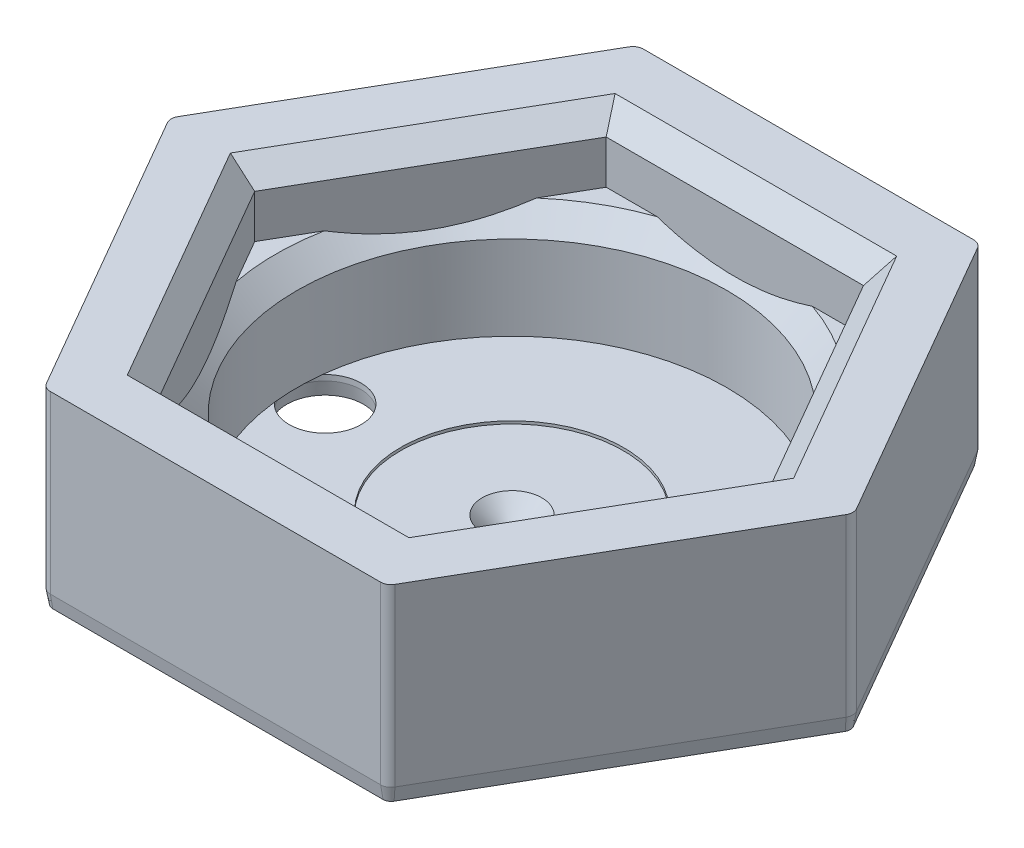
from build123d import *
from OCP.BRepFilletAPI import BRepFilletAPI_MakeChamfer

# Parameters (mm, degrees)
BOSS_EXTRUDE1_DEPTH = 27
SKETCH1_5_R         = 1.25
BOSS_EXTRUDE2_DEPTH = 2.8
BOSS_EXTRUDE3_START = 2.8
SKETCH1_6_R         = 30.625
BOSS_EXTRUDE3_DEPTH = 15
CUT_EXTRUDE2_START  = 2.8
SKETCH1_8_R         = 5.125
CUT_EXTRUDE2_DEPTH  = 10
CUT_EXTRUDE1_START  = 2.8
SKETCH1_7_R         = 15.875
CUT_EXTRUDE1_DEPTH  = 0.4
CHAMFER1_SIZE       = 3
FILLET1_R           = 1.5
CHAMFER2_SIZE       = 3
CHAMFER3_SIZE       = 2
CHAMFER3_SIZE2      = 0.352653961
CHAMFER4_SIZE       = 2
CHAMFER4_SIZE2      = 0.352653961


with BuildPart() as part:
    # Sketch1 → Boss-Extrude1 (new body)
    with BuildSketch(Plane(origin=(0, 0, 0), x_dir=(1, 0, 0), z_dir=(0, 1, 0))):
        Polygon((-36.661742094, 0), (-18.330871047, 31.75), (-24.393048873, 42.25), (-48.786097747, 0), (-24.393048873, -42.25), (24.393048873, -42.25), (48.786097747, 0), (36.661742094, 0), (18.330871047, -31.75), (-18.330871047, -31.75), align=None)
        Polygon((-24.393048873, 42.25), (-18.330871047, 31.75), (18.330871047, 31.75), (24.393048873, 42.25), align=None)
        Polygon((24.393048873, 42.25), (18.330871047, 31.75), (36.661742094, 0), (48.786097747, 0), align=None)
    extrude(amount=BOSS_EXTRUDE1_DEPTH)

    # Sketch1<5> → Boss-Extrude2 (add)
    with BuildSketch(Plane(origin=(0, 0, 0), x_dir=(1, 0, 0), z_dir=(0, 1, 0))):
        Polygon((18.330871047, 31.75), (-18.330871047, 31.75), (-36.661742094, 0), (-18.330871047, -31.75), (18.330871047, -31.75), (36.661742094, 0), align=None)
        with Locations(Location((0, 0, 0), (0, 0, 270))):
            Circle(SKETCH1_5_R, mode=Mode.SUBTRACT)
    extrude(amount=BOSS_EXTRUDE2_DEPTH)

    # Sketch1<6> → Boss-Extrude3 (add)
    with BuildSketch(Plane(origin=(0, 0, 0), x_dir=(1, 0, 0), z_dir=(0, 1, 0)).offset(BOSS_EXTRUDE3_START)):
        Polygon((18.330871047, 31.75), (-18.330871047, 31.75), (-36.661742094, 0), (-18.330871047, -31.75), (18.330871047, -31.75), (36.661742094, 0), align=None)
        with Locations(Location((0, 0, 0), (0, 0, 270))):
            Circle(SKETCH1_6_R, mode=Mode.SUBTRACT)
    extrude(amount=BOSS_EXTRUDE3_DEPTH)

    # Sketch1<8> → Cut-Extrude2 (cut)
    with BuildSketch(Plane(origin=(0, 0, 0), x_dir=(1, 0, 0), z_dir=(0, 1, 0)).offset(CUT_EXTRUDE2_START)):
        with Locations(Location((26.625, 0, 0), (0, 0, 270))):
            Circle(SKETCH1_8_R)
        with Locations(Location((-26.625, 0, 0), (0, 0, 270))):
            Circle(SKETCH1_8_R)
    extrude(amount=-CUT_EXTRUDE2_DEPTH, mode=Mode.SUBTRACT)

    # Sketch1<7> → Cut-Extrude1 (cut)
    with BuildSketch(Plane(origin=(0, 0, 0), x_dir=(1, 0, 0), z_dir=(0, 1, 0)).offset(CUT_EXTRUDE1_START)):
        with Locations(Location((0, 0, 0), (0, 0, 270))):
            Circle(SKETCH1_7_R)
    extrude(amount=-CUT_EXTRUDE1_DEPTH, mode=Mode.SUBTRACT)

    # Chamfer1
    # the kernel refuses this chamfer: 3 mm, written as the material it takes off along each edge
    with BuildSketch(Plane(origin=(26.045920011, 27, 31.75), x_dir=(0, 0.027495876610586768, 0.9996219169112968), z_dir=(-1, 0, 0))) as chamfer1_piece_1_section:
        Polygon((CHAMFER1_SIZE * 0.999621916911, -CHAMFER1_SIZE * 0.0274958766106), (-CHAMFER1_SIZE * 0.0274958766106, -CHAMFER1_SIZE * 0.999621916911), (0, 0), align=None)
    chamfer1_piece_1 = extrude(amount=52.091840021, mode=Mode.PRIVATE)
    chamfer1_piece_1 = split(chamfer1_piece_1, bisect_by=Plane(origin=(13.32778404, 26.000686335, 40.41560089), z_dir=(-0.8660254037844387, 0, -0.5000000000000001)), keep=Keep.TOP, mode=Mode.PRIVATE)
    chamfer1_piece_1 = split(chamfer1_piece_1, bisect_by=Plane(origin=(-13.32778404, 26.000686335, 40.41560089), z_dir=(0.8660254037844386, 0, -0.5000000000000002)), keep=Keep.TOP, mode=Mode.PRIVATE)
    add(chamfer1_piece_1, mode=Mode.SUBTRACT)
    with BuildSketch(Plane(origin=(-14.473346565, 27, 38.431428394), x_dir=(-0.8656979742248803, 0.02749587661058676, 0.4998109584556486), z_dir=(-0.5000000000000002, 0, -0.8660254037844386))) as chamfer1_piece_2_section:
        Polygon((CHAMFER1_SIZE * 0.999621916911, -CHAMFER1_SIZE * 0.0274958766106), (-CHAMFER1_SIZE * 0.0274958766106, -CHAMFER1_SIZE * 0.999621916911), (0, 0), align=None)
    chamfer1_piece_2 = extrude(amount=52.091840021, mode=Mode.PRIVATE)
    chamfer1_piece_2 = split(chamfer1_piece_2, bisect_by=Plane(origin=(-28.33704506, 26.000686335, 31.75), z_dir=(0, 0, -1)), keep=Keep.TOP, mode=Mode.PRIVATE)
    chamfer1_piece_2 = split(chamfer1_piece_2, bisect_by=Plane(origin=(-41.6648291, 26.000686335, 8.66560089), z_dir=(0.8660254037844387, 0, 0.5000000000000001)), keep=Keep.TOP, mode=Mode.PRIVATE)
    add(chamfer1_piece_2, mode=Mode.SUBTRACT)
    with BuildSketch(Plane(origin=(-40.519266575, 27, 6.681428394), x_dir=(-0.8656979742248804, 0.02749587661058679, -0.49981095845564844), z_dir=(0.5000000000000001, 0, -0.8660254037844387))) as chamfer1_piece_3_section:
        Polygon((CHAMFER1_SIZE * 0.999621916911, -CHAMFER1_SIZE * 0.0274958766106), (-CHAMFER1_SIZE * 0.0274958766106, -CHAMFER1_SIZE * 0.999621916911), (0, 0), align=None)
    chamfer1_piece_3 = extrude(amount=52.091840021, mode=Mode.PRIVATE)
    chamfer1_piece_3 = split(chamfer1_piece_3, bisect_by=Plane(origin=(-41.6648291, 26.000686335, -8.66560089), z_dir=(0.8660254037844386, 0, -0.5000000000000002)), keep=Keep.TOP, mode=Mode.PRIVATE)
    chamfer1_piece_3 = split(chamfer1_piece_3, bisect_by=Plane(origin=(-28.33704506, 26.000686335, -31.75), z_dir=(0, 0, 1)), keep=Keep.TOP, mode=Mode.PRIVATE)
    add(chamfer1_piece_3, mode=Mode.SUBTRACT)
    with BuildSketch(Plane(origin=(-26.045920011, 27, -31.75), x_dir=(0, 0.027495876610586733, -0.9996219169112968), z_dir=(1, 0, 0))) as chamfer1_piece_4_section:
        Polygon((CHAMFER1_SIZE * 0.999621916911, -CHAMFER1_SIZE * 0.0274958766106), (-CHAMFER1_SIZE * 0.0274958766106, -CHAMFER1_SIZE * 0.999621916911), (0, 0), align=None)
    chamfer1_piece_4 = extrude(amount=52.091840021, mode=Mode.PRIVATE)
    chamfer1_piece_4 = split(chamfer1_piece_4, bisect_by=Plane(origin=(-13.32778404, 26.000686335, -40.41560089), z_dir=(0.8660254037844387, 0, 0.5000000000000001)), keep=Keep.TOP, mode=Mode.PRIVATE)
    chamfer1_piece_4 = split(chamfer1_piece_4, bisect_by=Plane(origin=(13.32778404, 26.000686335, -40.41560089), z_dir=(-0.8660254037844385, 0, 0.5000000000000004)), keep=Keep.TOP, mode=Mode.PRIVATE)
    add(chamfer1_piece_4, mode=Mode.SUBTRACT)
    with BuildSketch(Plane(origin=(14.473346565, 27, -38.431428394), x_dir=(0.86569797422488, 0.02749587661058676, -0.4998109584556487), z_dir=(0.5000000000000004, 0, 0.8660254037844385))) as chamfer1_piece_5_section:
        Polygon((CHAMFER1_SIZE * 0.999621916911, -CHAMFER1_SIZE * 0.0274958766106), (-CHAMFER1_SIZE * 0.0274958766106, -CHAMFER1_SIZE * 0.999621916911), (0, 0), align=None)
    chamfer1_piece_5 = extrude(amount=52.091840021, mode=Mode.PRIVATE)
    chamfer1_piece_5 = split(chamfer1_piece_5, bisect_by=Plane(origin=(41.6648291, 26.000686335, -8.66560089), z_dir=(-0.8660254037844387, 0, -0.5000000000000001)), keep=Keep.TOP, mode=Mode.PRIVATE)
    chamfer1_piece_5 = split(chamfer1_piece_5, bisect_by=Plane(origin=(28.33704506, 26.000686335, -31.75), z_dir=(0, 0, 1)), keep=Keep.TOP, mode=Mode.PRIVATE)
    add(chamfer1_piece_5, mode=Mode.SUBTRACT)
    with BuildSketch(Plane(origin=(40.519266575, 27, -6.681428394), x_dir=(0.8656979742248803, 0.02749587661058679, 0.4998109584556484), z_dir=(-0.5000000000000001, 0, 0.8660254037844387))) as chamfer1_piece_6_section:
        Polygon((CHAMFER1_SIZE * 0.999621916911, -CHAMFER1_SIZE * 0.0274958766106), (-CHAMFER1_SIZE * 0.0274958766106, -CHAMFER1_SIZE * 0.999621916911), (0, 0), align=None)
    chamfer1_piece_6 = extrude(amount=52.091840021, mode=Mode.PRIVATE)
    chamfer1_piece_6 = split(chamfer1_piece_6, bisect_by=Plane(origin=(28.33704506, 26.000686335, 31.75), z_dir=(0, 0, -1)), keep=Keep.TOP, mode=Mode.PRIVATE)
    chamfer1_piece_6 = split(chamfer1_piece_6, bisect_by=Plane(origin=(41.6648291, 26.000686335, 8.66560089), z_dir=(-0.8660254037844385, 0, 0.5000000000000004)), keep=Keep.TOP, mode=Mode.PRIVATE)
    add(chamfer1_piece_6, mode=Mode.SUBTRACT)
    with BuildSketch(Plane(origin=(0, 17.8, 0), x_dir=(0, 0, 1), z_dir=(-1, 0, 0))) as chamfer1_piece_7_section:
        Polygon((30.625 + CHAMFER1_SIZE, 0), (30.625, -CHAMFER1_SIZE), (30.625, 0), align=None)
    chamfer1_piece_7 = revolve(axis=Axis((0, 17.8, 0), (0, 1, 0)), mode=Mode.PRIVATE)
    chamfer1_piece_7 = split(chamfer1_piece_7, bisect_by=Plane(origin=(27.49630657, 15.310214491, 15.875), z_dir=(-0.8660254037844387, 0, -0.5000000000000001)), keep=Keep.TOP, mode=Mode.PRIVATE)
    chamfer1_piece_7 = split(chamfer1_piece_7, bisect_by=Plane(origin=(26.848215095, 15.310214491, 31.75), z_dir=(0, 0, -1)), keep=Keep.TOP, mode=Mode.PRIVATE)
    chamfer1_piece_7 = split(chamfer1_piece_7, bisect_by=Plane(origin=(-14.072199023, 15.310214491, 39.126236318), z_dir=(0.8660254037844386, 0, -0.5000000000000002)), keep=Keep.TOP, mode=Mode.PRIVATE)
    chamfer1_piece_7 = split(chamfer1_piece_7, bisect_by=Plane(origin=(-27.49630657, 15.310214491, -15.875), z_dir=(0.8660254037844387, 0, 0.5000000000000001)), keep=Keep.TOP, mode=Mode.PRIVATE)
    chamfer1_piece_7 = split(chamfer1_piece_7, bisect_by=Plane(origin=(26.848215095, 15.310214491, -31.75), z_dir=(0, 0, 1)), keep=Keep.TOP, mode=Mode.PRIVATE)
    chamfer1_piece_7 = split(chamfer1_piece_7, bisect_by=Plane(origin=(40.920414118, 15.310214491, 7.376236318), z_dir=(-0.8660254037844385, 0, 0.5000000000000004)), keep=Keep.TOP, mode=Mode.PRIVATE)
    add(chamfer1_piece_7, mode=Mode.SUBTRACT)
    with BuildSketch(Plane(origin=(40.519266575, 27, -6.681428394), x_dir=(0.8656979742248803, 0.02749587661058679, 0.4998109584556484), z_dir=(-0.5000000000000001, 0, 0.8660254037844387))) as chamfer1_piece_8a_section:
        Polygon((CHAMFER1_SIZE * 0.999621916911, -CHAMFER1_SIZE * 0.0274958766106), (-CHAMFER1_SIZE * 0.0274958766106, -CHAMFER1_SIZE * 0.999621916911), (0, 0), align=None)
    chamfer1_piece_8a = extrude(amount=52.091840021, mode=Mode.PRIVATE)
    chamfer1_piece_8a = split(chamfer1_piece_8a, bisect_by=Plane(origin=(17.441976447, 26.031907688, 31.75), z_dir=(0, 0, 1)), keep=Keep.TOP, mode=Mode.PRIVATE)
    with BuildSketch(Plane(origin=(26.045920011, 27, 31.75), x_dir=(0, 0.027495876610586768, 0.9996219169112968), z_dir=(-1, 0, 0))) as chamfer1_piece_8b_section:
        Polygon((CHAMFER1_SIZE * 0.999621916911, -CHAMFER1_SIZE * 0.0274958766106), (-CHAMFER1_SIZE * 0.0274958766106, -CHAMFER1_SIZE * 0.999621916911), (0, 0), align=None)
    chamfer1_piece_8b = extrude(amount=52.091840021, mode=Mode.PRIVATE)
    chamfer1_piece_8b = split(chamfer1_piece_8b, bisect_by=Plane(origin=(18.775318347, 26.031907688, 30.980194695), z_dir=(0.8660254037844387, 0, 0.5000000000000001)), keep=Keep.TOP, mode=Mode.PRIVATE)
    chamfer1_piece_8 = chamfer1_piece_8a & chamfer1_piece_8b
    add(chamfer1_piece_8, mode=Mode.SUBTRACT)
    with BuildSketch(Plane(origin=(26.045920011, 27, 31.75), x_dir=(0, 0.027495876610586768, 0.9996219169112968), z_dir=(-1, 0, 0))) as chamfer1_piece_9a_section:
        Polygon((CHAMFER1_SIZE * 0.999621916911, -CHAMFER1_SIZE * 0.0274958766106), (-CHAMFER1_SIZE * 0.0274958766106, -CHAMFER1_SIZE * 0.999621916911), (0, 0), align=None)
    chamfer1_piece_9a = extrude(amount=52.091840021, mode=Mode.PRIVATE)
    chamfer1_piece_9a = split(chamfer1_piece_9a, bisect_by=Plane(origin=(-18.775318347, 26.031907688, 30.980194695), z_dir=(-0.8660254037844386, 0, 0.5000000000000002)), keep=Keep.TOP, mode=Mode.PRIVATE)
    with BuildSketch(Plane(origin=(-14.473346565, 27, 38.431428394), x_dir=(-0.8656979742248803, 0.02749587661058676, 0.4998109584556486), z_dir=(-0.5000000000000002, 0, -0.8660254037844386))) as chamfer1_piece_9b_section:
        Polygon((CHAMFER1_SIZE * 0.999621916911, -CHAMFER1_SIZE * 0.0274958766106), (-CHAMFER1_SIZE * 0.0274958766106, -CHAMFER1_SIZE * 0.999621916911), (0, 0), align=None)
    chamfer1_piece_9b = extrude(amount=52.091840021, mode=Mode.PRIVATE)
    chamfer1_piece_9b = split(chamfer1_piece_9b, bisect_by=Plane(origin=(-17.441976447, 26.031907688, 31.75), z_dir=(0, 0, 1)), keep=Keep.TOP, mode=Mode.PRIVATE)
    chamfer1_piece_9 = chamfer1_piece_9a & chamfer1_piece_9b
    add(chamfer1_piece_9, mode=Mode.SUBTRACT)
    with BuildSketch(Plane(origin=(-14.473346565, 27, 38.431428394), x_dir=(-0.8656979742248803, 0.02749587661058676, 0.4998109584556486), z_dir=(-0.5000000000000002, 0, -0.8660254037844386))) as chamfer1_piece_10a_section:
        Polygon((CHAMFER1_SIZE * 0.999621916911, -CHAMFER1_SIZE * 0.0274958766106), (-CHAMFER1_SIZE * 0.0274958766106, -CHAMFER1_SIZE * 0.999621916911), (0, 0), align=None)
    chamfer1_piece_10a = extrude(amount=52.091840021, mode=Mode.PRIVATE)
    chamfer1_piece_10a = split(chamfer1_piece_10a, bisect_by=Plane(origin=(-36.217294794, 26.031907688, -0.769805305), z_dir=(-0.8660254037844387, 0, -0.5000000000000001)), keep=Keep.TOP, mode=Mode.PRIVATE)
    with BuildSketch(Plane(origin=(-40.519266575, 27, 6.681428394), x_dir=(-0.8656979742248804, 0.02749587661058679, -0.49981095845564844), z_dir=(0.5000000000000001, 0, -0.8660254037844387))) as chamfer1_piece_10b_section:
        Polygon((CHAMFER1_SIZE * 0.999621916911, -CHAMFER1_SIZE * 0.0274958766106), (-CHAMFER1_SIZE * 0.0274958766106, -CHAMFER1_SIZE * 0.999621916911), (0, 0), align=None)
    chamfer1_piece_10b = extrude(amount=52.091840021, mode=Mode.PRIVATE)
    chamfer1_piece_10b = split(chamfer1_piece_10b, bisect_by=Plane(origin=(-36.217294794, 26.031907688, 0.769805305), z_dir=(-0.8660254037844386, 0, 0.5000000000000002)), keep=Keep.TOP, mode=Mode.PRIVATE)
    chamfer1_piece_10 = chamfer1_piece_10a & chamfer1_piece_10b
    add(chamfer1_piece_10, mode=Mode.SUBTRACT)
    with BuildSketch(Plane(origin=(-40.519266575, 27, 6.681428394), x_dir=(-0.8656979742248804, 0.02749587661058679, -0.49981095845564844), z_dir=(0.5000000000000001, 0, -0.8660254037844387))) as chamfer1_piece_11a_section:
        Polygon((CHAMFER1_SIZE * 0.999621916911, -CHAMFER1_SIZE * 0.0274958766106), (-CHAMFER1_SIZE * 0.0274958766106, -CHAMFER1_SIZE * 0.999621916911), (0, 0), align=None)
    chamfer1_piece_11a = extrude(amount=52.091840021, mode=Mode.PRIVATE)
    chamfer1_piece_11a = split(chamfer1_piece_11a, bisect_by=Plane(origin=(-17.441976447, 26.031907688, -31.75), z_dir=(0, 0, -1)), keep=Keep.TOP, mode=Mode.PRIVATE)
    with BuildSketch(Plane(origin=(-26.045920011, 27, -31.75), x_dir=(0, 0.027495876610586733, -0.9996219169112968), z_dir=(1, 0, 0))) as chamfer1_piece_11b_section:
        Polygon((CHAMFER1_SIZE * 0.999621916911, -CHAMFER1_SIZE * 0.0274958766106), (-CHAMFER1_SIZE * 0.0274958766106, -CHAMFER1_SIZE * 0.999621916911), (0, 0), align=None)
    chamfer1_piece_11b = extrude(amount=52.091840021, mode=Mode.PRIVATE)
    chamfer1_piece_11b = split(chamfer1_piece_11b, bisect_by=Plane(origin=(-18.775318347, 26.031907688, -30.980194695), z_dir=(-0.8660254037844387, 0, -0.5000000000000001)), keep=Keep.TOP, mode=Mode.PRIVATE)
    chamfer1_piece_11 = chamfer1_piece_11a & chamfer1_piece_11b
    add(chamfer1_piece_11, mode=Mode.SUBTRACT)
    with BuildSketch(Plane(origin=(-26.045920011, 27, -31.75), x_dir=(0, 0.027495876610586733, -0.9996219169112968), z_dir=(1, 0, 0))) as chamfer1_piece_12a_section:
        Polygon((CHAMFER1_SIZE * 0.999621916911, -CHAMFER1_SIZE * 0.0274958766106), (-CHAMFER1_SIZE * 0.0274958766106, -CHAMFER1_SIZE * 0.999621916911), (0, 0), align=None)
    chamfer1_piece_12a = extrude(amount=52.091840021, mode=Mode.PRIVATE)
    chamfer1_piece_12a = split(chamfer1_piece_12a, bisect_by=Plane(origin=(18.775318347, 26.031907688, -30.980194695), z_dir=(0.8660254037844385, 0, -0.5000000000000004)), keep=Keep.TOP, mode=Mode.PRIVATE)
    with BuildSketch(Plane(origin=(14.473346565, 27, -38.431428394), x_dir=(0.86569797422488, 0.02749587661058676, -0.4998109584556487), z_dir=(0.5000000000000004, 0, 0.8660254037844385))) as chamfer1_piece_12b_section:
        Polygon((CHAMFER1_SIZE * 0.999621916911, -CHAMFER1_SIZE * 0.0274958766106), (-CHAMFER1_SIZE * 0.0274958766106, -CHAMFER1_SIZE * 0.999621916911), (0, 0), align=None)
    chamfer1_piece_12b = extrude(amount=52.091840021, mode=Mode.PRIVATE)
    chamfer1_piece_12b = split(chamfer1_piece_12b, bisect_by=Plane(origin=(17.441976447, 26.031907688, -31.75), z_dir=(0, 0, -1)), keep=Keep.TOP, mode=Mode.PRIVATE)
    chamfer1_piece_12 = chamfer1_piece_12a & chamfer1_piece_12b
    add(chamfer1_piece_12, mode=Mode.SUBTRACT)
    with BuildSketch(Plane(origin=(40.519266575, 27, -6.681428394), x_dir=(0.8656979742248803, 0.02749587661058679, 0.4998109584556484), z_dir=(-0.5000000000000001, 0, 0.8660254037844387))) as chamfer1_piece_13a_section:
        Polygon((CHAMFER1_SIZE * 0.999621916911, -CHAMFER1_SIZE * 0.0274958766106), (-CHAMFER1_SIZE * 0.0274958766106, -CHAMFER1_SIZE * 0.999621916911), (0, 0), align=None)
    chamfer1_piece_13a = extrude(amount=52.091840021, mode=Mode.PRIVATE)
    chamfer1_piece_13a = split(chamfer1_piece_13a, bisect_by=Plane(origin=(36.217294794, 26.031907688, -0.769805305), z_dir=(0.8660254037844385, 0, -0.5000000000000004)), keep=Keep.TOP, mode=Mode.PRIVATE)
    with BuildSketch(Plane(origin=(14.473346565, 27, -38.431428394), x_dir=(0.86569797422488, 0.02749587661058676, -0.4998109584556487), z_dir=(0.5000000000000004, 0, 0.8660254037844385))) as chamfer1_piece_13b_section:
        Polygon((CHAMFER1_SIZE * 0.999621916911, -CHAMFER1_SIZE * 0.0274958766106), (-CHAMFER1_SIZE * 0.0274958766106, -CHAMFER1_SIZE * 0.999621916911), (0, 0), align=None)
    chamfer1_piece_13b = extrude(amount=52.091840021, mode=Mode.PRIVATE)
    chamfer1_piece_13b = split(chamfer1_piece_13b, bisect_by=Plane(origin=(36.217294794, 26.031907688, 0.769805305), z_dir=(0.8660254037844387, 0, 0.5000000000000001)), keep=Keep.TOP, mode=Mode.PRIVATE)
    chamfer1_piece_13 = chamfer1_piece_13a & chamfer1_piece_13b
    add(chamfer1_piece_13, mode=Mode.SUBTRACT)

    # Fillet1
    fillet1_edges = [part.edges().sort_by_distance(p)[0] for p in [
        (-24.393048873, 13.5, 42.25),
        (-48.786097747, 13.5, 0),
        (-24.393048873, 13.5, -42.25),
        (24.393048873, 13.5, -42.25),
        (48.786097747, 13.5, 0),
        (24.393048873, 13.5, 42.25),
    ]]
    fillet(fillet1_edges, radius=FILLET1_R)

    # Chamfer2
    # the kernel refuses this chamfer: 3 mm, written as the material it takes off along each edge
    with BuildSketch(Plane(origin=(0, 2.4, 0), x_dir=(0, 0, 1), z_dir=(1, 0, 0))) as chamfer2_piece_1:
        Polygon((1.25, CHAMFER2_SIZE), (1.25 + CHAMFER2_SIZE, 0), (1.25, 0), align=None)
    revolve(axis=Axis((0, 2.4, 0), (0, -1, 0)), mode=Mode.SUBTRACT)

    # Chamfer3: one chamfer whose edges measure the first distance from different faces: ONE call of the kernel's chamfer builder (chamfer() names one face for all edges)
    chamfer3_edges_1 = [part.edges().sort_by_distance(p)[0] for p in [
        (-26.625, 0, -5.125),
    ]]
    chamfer3_side_1 = [part.faces().sort_by_distance(p)[0] for p in [
        (-26.625, 1.4, -5.125),
    ]]
    chamfer3_edges_2 = [part.edges().sort_by_distance(p)[0] for p in [
        (26.625, 0, -5.125),
    ]]
    chamfer3_side_2 = [part.faces().sort_by_distance(p)[0] for p in [
        (26.625, 1.4, -5.125),
    ]]
    chamfer3 = BRepFilletAPI_MakeChamfer(part.part.solid().wrapped)
    for e in chamfer3_edges_1:
        chamfer3.Add(CHAMFER3_SIZE, CHAMFER3_SIZE2, e.wrapped, chamfer3_side_1[0].wrapped)  # the first distance lies on this face
    for e in chamfer3_edges_2:
        chamfer3.Add(CHAMFER3_SIZE, CHAMFER3_SIZE2, e.wrapped, chamfer3_side_2[0].wrapped)  # the first distance lies on this face
    add(Compound.cast(chamfer3.Shape()), mode=Mode.REPLACE)

    # Chamfer4: one chamfer whose edges measure the first distance from different faces: ONE call of the kernel's chamfer builder (chamfer() names one face for all edges)
    chamfer4_edges_1 = [part.edges().sort_by_distance(p)[0] for p in [
        (0, 0, -42.25),
    ]]
    chamfer4_side_1 = [part.faces().sort_by_distance(p)[0] for p in [
        (0, 13.5, -42.25),
    ]]
    chamfer4_edges_2 = [part.edges().sort_by_distance(p)[0] for p in [
        (0, 0, 42.25),
    ]]
    chamfer4_side_2 = [part.faces().sort_by_distance(p)[0] for p in [
        (0, 13.5, 42.25),
    ]]
    chamfer4_edges_3 = [part.edges().sort_by_distance(p)[0] for p in [
        (-36.58957331, 0, 21.125),
    ]]
    chamfer4_side_3 = [part.faces().sort_by_distance(p)[0] for p in [
        (-36.58957331, 13.5, 21.125),
    ]]
    chamfer4_edges_4 = [part.edges().sort_by_distance(p)[0] for p in [
        (-36.58957331, 0, -21.125),
    ]]
    chamfer4_side_4 = [part.faces().sort_by_distance(p)[0] for p in [
        (-36.58957331, 13.5, -21.125),
    ]]
    chamfer4_edges_5 = [part.edges().sort_by_distance(p)[0] for p in [
        (36.58957331, 0, -21.125),
    ]]
    chamfer4_side_5 = [part.faces().sort_by_distance(p)[0] for p in [
        (36.58957331, 13.5, -21.125),
    ]]
    chamfer4_edges_6 = [part.edges().sort_by_distance(p)[0] for p in [
        (36.58957331, 0, 21.125),
    ]]
    chamfer4_side_6 = [part.faces().sort_by_distance(p)[0] for p in [
        (36.58957331, 13.5, 21.125),
    ]]
    chamfer4_edges_7 = [part.edges().sort_by_distance(p)[0] for p in [
        (-48.554046939, 0, 0),
    ]]
    chamfer4_side_7 = [part.faces().sort_by_distance(p)[0] for p in [
        (-48.554046939, 13.5, 0),
    ]]
    chamfer4_edges_8 = [part.edges().sort_by_distance(p)[0] for p in [
        (-24.277023469, 0, 42.049038106),
    ]]
    chamfer4_side_8 = [part.faces().sort_by_distance(p)[0] for p in [
        (-24.277023469, 13.5, 42.049038106),
    ]]
    chamfer4_edges_9 = [part.edges().sort_by_distance(p)[0] for p in [
        (24.277023469, 0, 42.049038106),
    ]]
    chamfer4_side_9 = [part.faces().sort_by_distance(p)[0] for p in [
        (24.277023469, 13.5, 42.049038106),
    ]]
    chamfer4_edges_10 = [part.edges().sort_by_distance(p)[0] for p in [
        (48.554046939, 0, 0),
    ]]
    chamfer4_side_10 = [part.faces().sort_by_distance(p)[0] for p in [
        (48.554046939, 13.5, 0),
    ]]
    chamfer4_edges_11 = [part.edges().sort_by_distance(p)[0] for p in [
        (-24.277023469, 0, -42.049038106),
    ]]
    chamfer4_side_11 = [part.faces().sort_by_distance(p)[0] for p in [
        (-24.277023469, 13.5, -42.049038106),
    ]]
    chamfer4_edges_12 = [part.edges().sort_by_distance(p)[0] for p in [
        (24.277023469, 0, -42.049038106),
    ]]
    chamfer4_side_12 = [part.faces().sort_by_distance(p)[0] for p in [
        (24.277023469, 13.5, -42.049038106),
    ]]
    chamfer4 = BRepFilletAPI_MakeChamfer(part.part.solid().wrapped)
    for e in chamfer4_edges_1:
        chamfer4.Add(CHAMFER4_SIZE, CHAMFER4_SIZE2, e.wrapped, chamfer4_side_1[0].wrapped)  # the first distance lies on this face
    for e in chamfer4_edges_2:
        chamfer4.Add(CHAMFER4_SIZE, CHAMFER4_SIZE2, e.wrapped, chamfer4_side_2[0].wrapped)  # the first distance lies on this face
    for e in chamfer4_edges_3:
        chamfer4.Add(CHAMFER4_SIZE, CHAMFER4_SIZE2, e.wrapped, chamfer4_side_3[0].wrapped)  # the first distance lies on this face
    for e in chamfer4_edges_4:
        chamfer4.Add(CHAMFER4_SIZE, CHAMFER4_SIZE2, e.wrapped, chamfer4_side_4[0].wrapped)  # the first distance lies on this face
    for e in chamfer4_edges_5:
        chamfer4.Add(CHAMFER4_SIZE, CHAMFER4_SIZE2, e.wrapped, chamfer4_side_5[0].wrapped)  # the first distance lies on this face
    for e in chamfer4_edges_6:
        chamfer4.Add(CHAMFER4_SIZE, CHAMFER4_SIZE2, e.wrapped, chamfer4_side_6[0].wrapped)  # the first distance lies on this face
    for e in chamfer4_edges_7:
        chamfer4.Add(CHAMFER4_SIZE, CHAMFER4_SIZE2, e.wrapped, chamfer4_side_7[0].wrapped)  # the first distance lies on this face
    for e in chamfer4_edges_8:
        chamfer4.Add(CHAMFER4_SIZE, CHAMFER4_SIZE2, e.wrapped, chamfer4_side_8[0].wrapped)  # the first distance lies on this face
    for e in chamfer4_edges_9:
        chamfer4.Add(CHAMFER4_SIZE, CHAMFER4_SIZE2, e.wrapped, chamfer4_side_9[0].wrapped)  # the first distance lies on this face
    for e in chamfer4_edges_10:
        chamfer4.Add(CHAMFER4_SIZE, CHAMFER4_SIZE2, e.wrapped, chamfer4_side_10[0].wrapped)  # the first distance lies on this face
    for e in chamfer4_edges_11:
        chamfer4.Add(CHAMFER4_SIZE, CHAMFER4_SIZE2, e.wrapped, chamfer4_side_11[0].wrapped)  # the first distance lies on this face
    for e in chamfer4_edges_12:
        chamfer4.Add(CHAMFER4_SIZE, CHAMFER4_SIZE2, e.wrapped, chamfer4_side_12[0].wrapped)  # the first distance lies on this face
    add(Compound.cast(chamfer4.Shape()), mode=Mode.REPLACE)


solid = part.part
